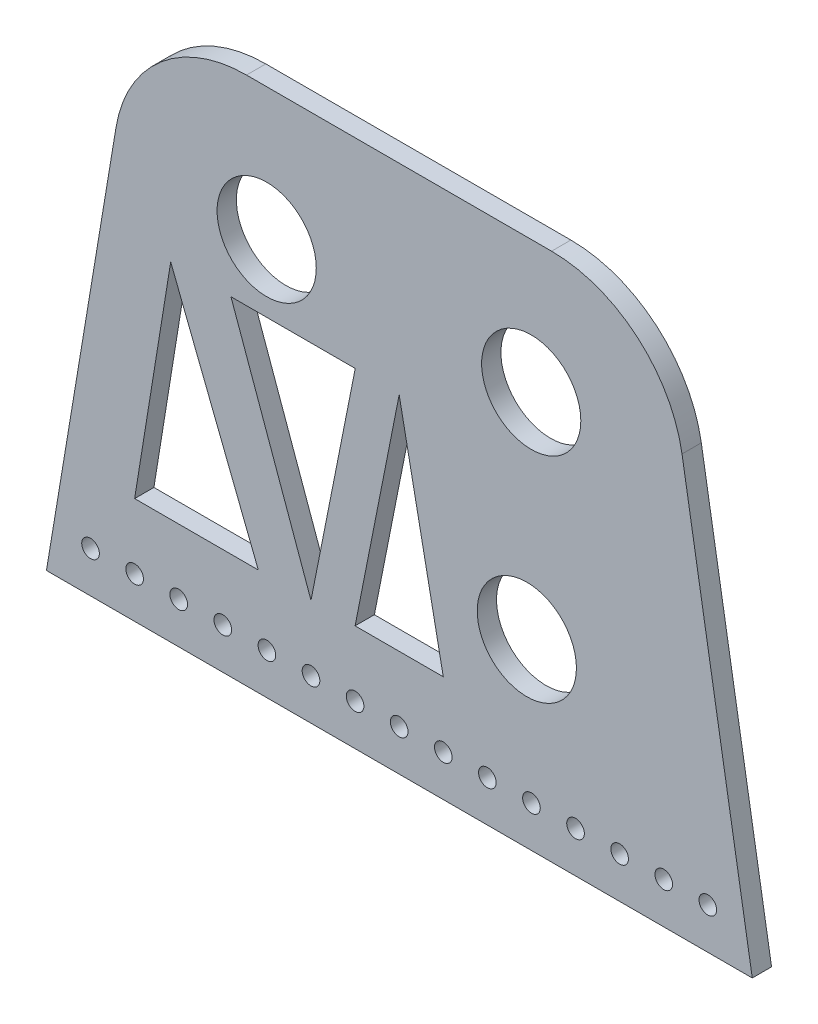
from build123d import *

# Parameters (mm, degrees)
SKETCH2_R           = 14.2875
SKETCH2_R_2         = 2.54
BOSS_EXTRUDE1_DEPTH = 5.55625
FILLET1_R           = 38.1


with BuildPart() as part:
    # Sketch2 → Boss-Extrude1 (new body)
    with BuildSketch(Plane.XY):
        Polygon((-33.221954044, -123.033671084), (-58.55568732, -123.033671084), (-33.221954044, 29.366328916), (119.178045956, 29.366328916), (144.745882617, -123.033671084), (119.178045956, -123.033671084), align=None)
        with Locations((4.878045956, -8.733671084)):
            Circle(SKETCH2_R, mode=Mode.SUBTRACT)
        with Locations((81.078045956, -8.733671084)):
            Circle(SKETCH2_R, mode=Mode.SUBTRACT)
        with Locations((-45.85568732, -111.187710863)):
            Circle(SKETCH2_R_2, mode=Mode.SUBTRACT)
        with Locations((-33.15568732, -111.187710863)):
            Circle(SKETCH2_R_2, mode=Mode.SUBTRACT)
        with Locations((-20.45568732, -111.187710863)):
            Circle(SKETCH2_R_2, mode=Mode.SUBTRACT)
        with Locations((-7.75568732, -111.187710863)):
            Circle(SKETCH2_R_2, mode=Mode.SUBTRACT)
        with Locations((4.94431268, -111.187710863)):
            Circle(SKETCH2_R_2, mode=Mode.SUBTRACT)
        with Locations((17.64431268, -111.187710863)):
            Circle(SKETCH2_R_2, mode=Mode.SUBTRACT)
        with Locations((30.34431268, -111.187710863)):
            Circle(SKETCH2_R_2, mode=Mode.SUBTRACT)
        with Locations((43.04431268, -111.187710863)):
            Circle(SKETCH2_R_2, mode=Mode.SUBTRACT)
        with Locations((55.74431268, -111.187710863)):
            Circle(SKETCH2_R_2, mode=Mode.SUBTRACT)
        with Locations((68.44431268, -111.187710863)):
            Circle(SKETCH2_R_2, mode=Mode.SUBTRACT)
        with Locations((81.14431268, -111.187710863)):
            Circle(SKETCH2_R_2, mode=Mode.SUBTRACT)
        with Locations((93.84431268, -111.187710863)):
            Circle(SKETCH2_R_2, mode=Mode.SUBTRACT)
        with Locations((106.54431268, -111.187710863)):
            Circle(SKETCH2_R_2, mode=Mode.SUBTRACT)
        with Locations((119.24431268, -111.187710863)):
            Circle(SKETCH2_R_2, mode=Mode.SUBTRACT)
        with Locations((131.94431268, -111.187710863)):
            Circle(SKETCH2_R_2, mode=Mode.SUBTRACT)
        with Locations((79.809453324, -71.051356873)):
            Circle(SKETCH2_R, mode=Mode.SUBTRACT)
        Polygon((-22.767796965, -28.16783361), (-33.15568732, -92.394571291), (2.468038836, -92.394571291), align=None, mode=Mode.SUBTRACT)
        Polygon((43.04431268, -28.399699089), (55.74431268, -92.394571291), (30.34431268, -92.394571291), align=None, mode=Mode.SUBTRACT)
        Polygon((17.64431268, -92.394571291), (30.390327173, -28.16783361), (-5.41538745, -28.16783361), align=None, mode=Mode.SUBTRACT)
    extrude(amount=BOSS_EXTRUDE1_DEPTH)

    # Fillet1
    fillet1_edges = [part.edges().sort_by_distance(p)[0] for p in [
        (-33.221954044, 29.366328916, 2.778125),
        (119.178045956, 29.366328916, 2.778125),
    ]]
    fillet(fillet1_edges, radius=FILLET1_R)


solid = part.part
